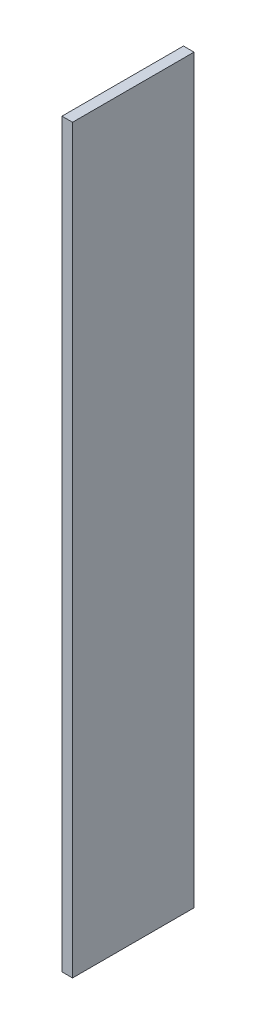
from build123d import *

# Parameters (mm, degrees)
SKETCH1_W           = 101.6
SKETCH1_H           = 1168.4
BOSS_EXTRUDE1_DEPTH = 7124.7


with BuildPart() as part:
    # Sketch1 → Boss-Extrude1 (new body)
    with BuildSketch(Plane(origin=(0, 0, 0), x_dir=(1, 0, 0), z_dir=(0, 1, 0))):
        Rectangle(SKETCH1_W, SKETCH1_H)
    extrude(amount=BOSS_EXTRUDE1_DEPTH)


solid = part.part
